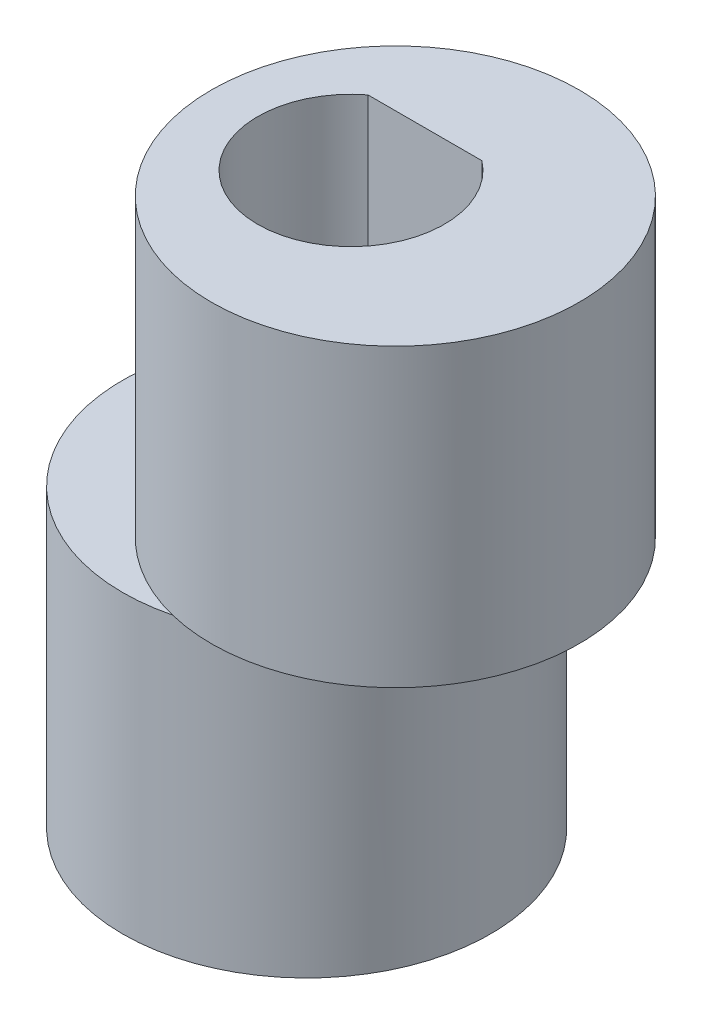
from build123d import *

# Parameters (mm, degrees)
SKETCH1_R               = 4.975
BOSS_EXTRUDE1_DEPTH     = 8
SKETCH2_R               = 4.975
BOSS_EXTRUDE2_DEPTH     = 8
CUT_EXTRUDE1_DEPTH      = 8
CUT_EXTRUDE1_DEPTH_BACK = 8
SKETCH4_R               = 2.525
BOSS_EXTRUDE3_START     = -10
BOSS_EXTRUDE3_DEPTH     = 10


with BuildPart() as part:
    # Sketch1 → Boss-Extrude1 (new body)
    with BuildSketch(Plane(origin=(0, 0, 0), x_dir=(1, 0, 0), z_dir=(0, 1, 0))):
        Circle(SKETCH1_R)
    extrude(amount=BOSS_EXTRUDE1_DEPTH)

    # Sketch2 → Boss-Extrude2 (add)
    with BuildSketch(Plane(origin=(0, 0, 0), x_dir=(1, 0, 0), z_dir=(0, 1, 0))):
        with Locations((-2.4, 0)):
            Circle(SKETCH2_R)
    extrude(amount=-BOSS_EXTRUDE2_DEPTH)

    # Sketch4 → Cut-Extrude1 (cut, two sides: drawn at the far end of the back side and taken through both)
    with BuildSketch(Plane(origin=(0, 0, 0), x_dir=(1, 0, 0), z_dir=(0, 1, 0)).offset(-CUT_EXTRUDE1_DEPTH_BACK)):
        with Locations((-1.2, 0)):
            Circle(SKETCH4_R)
    extrude(amount=CUT_EXTRUDE1_DEPTH + CUT_EXTRUDE1_DEPTH_BACK, mode=Mode.SUBTRACT)

    # Sketch5 → Boss-Extrude3 (add)
    with BuildSketch(Plane(origin=(0, 8, 0), x_dir=(1, 0, 0), z_dir=(0, 1, 0)).offset(BOSS_EXTRUDE3_START)):
        with BuildLine():
            Line((-2.741306264, 2), (0.341306264, 2))
            ThreePointArc((0.341306264, 2), (-1.2, 2.525), (-2.741306264, 2))
        make_face()
    extrude(amount=BOSS_EXTRUDE3_DEPTH)


solid = part.part
